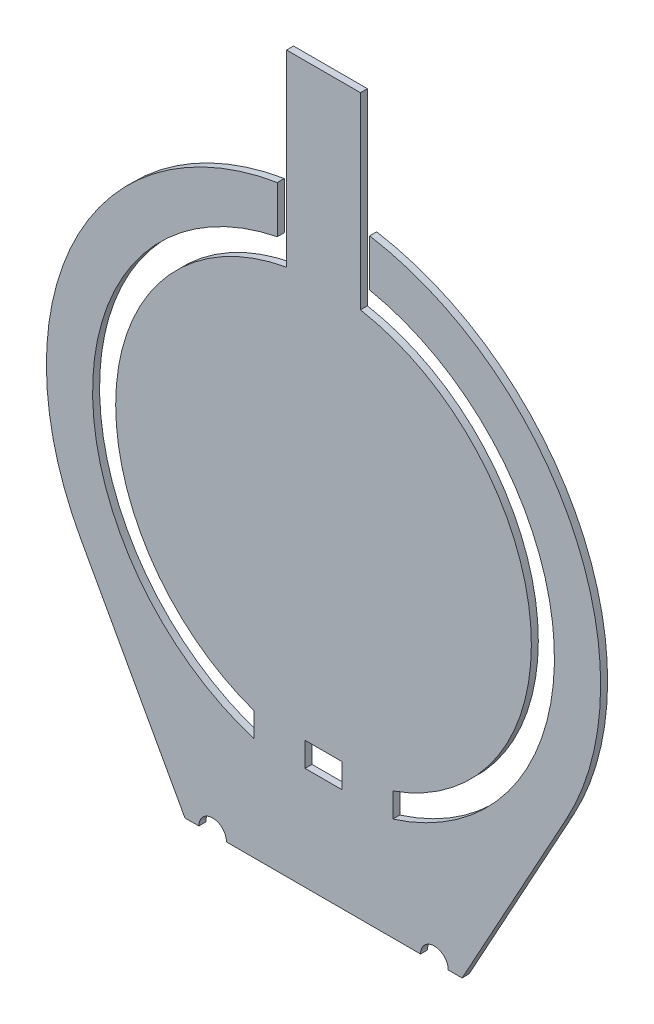
from build123d import *

# Parameters (mm, degrees)
BOSS_EXTRUDE1_DEPTH      = 0.75438
ESBO_O1_W                = 10
ESBO_O1_H                = 6.802785064
CORTE_EXTRUS_O1_DEPTH    = 10
RESSALTO_EXTRUS_O1_START = -0.75438
RESSALTO_EXTRUS_O1_DEPTH = 0.75438
CORTE_EXTRUS_O2_DEPTH    = 10
ESBO_O5_W                = 4
ESBO_O5_H                = 2.635276599
CORTE_EXTRUS_O3_DEPTH    = 10


with BuildPart() as part:
    # Sketch1 → Boss-Extrude1 (new body)
    with BuildSketch(Plane.XY):
        with BuildLine():
            Line((-26.292884648, -14.44590658), (-15, -35))
            Line((-15, -35), (-7.5, -35))
            Line((-7.5, -35), (-5, -35))
            Line((-5, -35), (15, -35))
            Line((15, -35), (26.292884648, -14.44590658))
            ThreePointArc((26.292884648, -14.44590658), (0, 30), (-26.292884648, -14.44590658))
        make_face()
        with BuildLine():
            Line((-7.5, -21.213203436), (-7.5, -23.848480035))
            ThreePointArc((-7.5, -23.848480035), (0, 25), (7.5, -23.848480035))
            Line((7.5, -23.848480035), (7.5, -21.213203436))
            ThreePointArc((7.5, -21.213203436), (0, 22.5), (-7.5, -21.213203436))
        make_face(mode=Mode.SUBTRACT)
    extrude(amount=BOSS_EXTRUDE1_DEPTH)

    # Esboço1 → Corte-extrusão1 (cut)
    with BuildSketch(Plane.XY.offset(0.75438)):
        with Locations((0, 27.5)):
            Rectangle(ESBO_O1_W, ESBO_O1_H)
    extrude(amount=-CORTE_EXTRUS_O1_DEPTH, mode=Mode.SUBTRACT)

    # Esboço3 → Ressalto-extrusão1 (add)
    with BuildSketch(Plane.XY.offset(0.75438).offset(RESSALTO_EXTRUS_O1_START)):
        with BuildLine():
            ThreePointArc((-4, 22.141589825), (0, 22.5), (4, 22.141589825))
            Line((4, 22.141589825), (4, 42.5))
            Line((4, 42.5), (-4, 42.5))
            Line((-4, 42.5), (-4, 22.141589825))
        make_face()
    extrude(amount=RESSALTO_EXTRUS_O1_DEPTH)

    # Esboço4 → Corte-extrusão2 (cut)
    with BuildSketch(Plane.XY.offset(0.75438)):
        with BuildLine():
            ThreePointArc((-10.5, -35), (-12, -33.5), (-13.5, -35))
            Line((-13.5, -35), (-10.5, -35))
        make_face()
        with BuildLine():
            ThreePointArc((13.5, -35), (12, -33.5), (10.5, -35))
            Line((10.5, -35), (13.5, -35))
        make_face()
    extrude(amount=-CORTE_EXTRUS_O2_DEPTH, mode=Mode.SUBTRACT)

    # Esboço5 → Corte-extrusão3 (cut)
    with BuildSketch(Plane.XY.offset(0.75438)):
        with Locations((0, -22.530841736)):
            Rectangle(ESBO_O5_W, ESBO_O5_H)
    extrude(amount=-CORTE_EXTRUS_O3_DEPTH, mode=Mode.SUBTRACT)


solid = part.part
